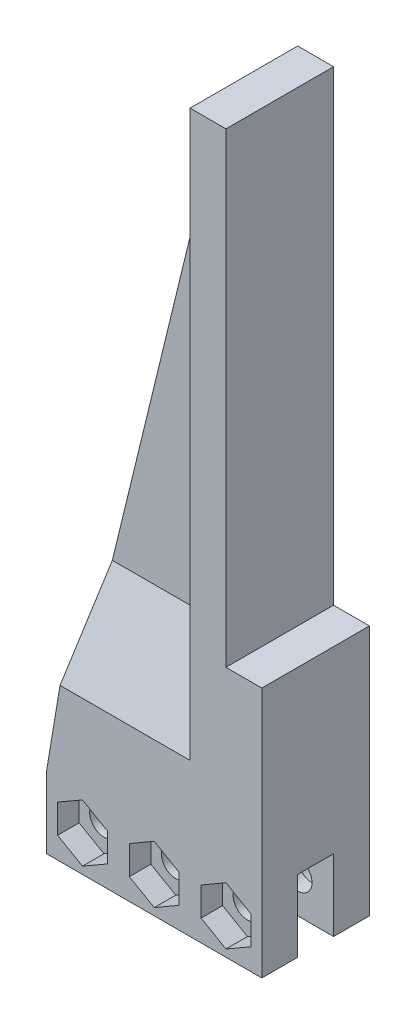
from build123d import *

# Parameters (mm, degrees)
SKETCH1_W                                        = 10
SKETCH1_H                                        = 65
SKETCH1_H_2                                      = 25
SKETCH1_W_2                                      = 5
SKETCH1_H_3                                      = 10
SKETCH1_W_3                                      = 15
BOSS_EXTRUDE1_DEPTH                              = 15
CBORE_FOR_M4_HEX_HEAD_MACHINE_SCREW1_D           = 4
CBORE_FOR_M4_HEX_HEAD_MACHINE_SCREW1_CBORE_D     = 8
CBORE_FOR_M4_HEX_HEAD_MACHINE_SCREW1_CBORE_DEPTH = 3
CUT_EXTRUDE1_DEPTH                               = 3
SKETCH7_W                                        = 5
SKETCH7_H                                        = 10
CUT_EXTRUDE2_DEPTH                               = 106.475115549
CUT_EXTRUDE3_DEPTH                               = 106.475115549
CUT_EXTRUDE4_DEPTH                               = 5
CUT_EXTRUDE5_DEPTH                               = 5
CHAMFER1_SIZE2                                   = 5
CHAMFER1_SIZE                                    = 13.737387097
CHAMFER2_SIZE2                                   = 5
CHAMFER2_SIZE                                    = 13.737387097


with BuildPart() as part:
    # Sketch1 → Boss-Extrude1 (new body)
    with BuildSketch(Plane.XY):
        Polygon((-30, 10), (-15, 10), (-15, 35), (-15, 100), align=None)
        with Locations((-10, 67.5)):
            Rectangle(SKETCH1_W, SKETCH1_H)
        with Locations((-10, 22.5)):
            Rectangle(SKETCH1_W, SKETCH1_H_2)
        with Locations((-2.5, 22.5)):
            Rectangle(SKETCH1_W_2, SKETCH1_H_2)
        with Locations((-2.5, 5)):
            Rectangle(SKETCH1_W_2, SKETCH1_H_3)
        with Locations((-10, 5)):
            Rectangle(SKETCH1_W, SKETCH1_H_3)
        with Locations((-22.5, 5)):
            Rectangle(SKETCH1_W_3, SKETCH1_H_3)
    extrude(amount=BOSS_EXTRUDE1_DEPTH)

    # CBORE for M4 Hex Head Machine Screw1 (through all)
    with Locations(Plane(origin=(0, 0, 0), x_dir=(-1, 0, 0), z_dir=(0, 0, -1))):
        with Locations((25, 5), (15, 5), (5, 5)):
            CounterBoreHole(CBORE_FOR_M4_HEX_HEAD_MACHINE_SCREW1_D / 2, CBORE_FOR_M4_HEX_HEAD_MACHINE_SCREW1_CBORE_D / 2, CBORE_FOR_M4_HEX_HEAD_MACHINE_SCREW1_CBORE_DEPTH)

    # Sketch6 → Cut-Extrude1 (cut)
    with BuildSketch(Plane.XY.offset(15)):
        Polygon((-15, 9), (-18.464101615, 7), (-18.464101615, 3), (-15, 1), (-11.535898385, 3), (-11.535898385, 7), align=None)
        Polygon((-25, 9), (-28.464101615, 7), (-28.464101615, 3), (-25, 1), (-21.535898385, 3), (-21.535898385, 7), align=None)
        Polygon((-5, 9), (-8.464101615, 7), (-8.464101615, 3), (-5, 1), (-1.535898385, 3), (-1.535898385, 7), align=None)
    extrude(amount=-CUT_EXTRUDE1_DEPTH, mode=Mode.SUBTRACT)

    # Sketch7 → Cut-Extrude2 (cut, through all)
    with BuildSketch(Plane.ZY.offset(30)):
        with Locations((7.5, 5)):
            Rectangle(SKETCH7_W, SKETCH7_H)
    extrude(amount=-CUT_EXTRUDE2_DEPTH, mode=Mode.SUBTRACT)

    # Sketch8 → Cut-Extrude3 (cut, through all)
    with BuildSketch(Plane(origin=(0, 0, 0), x_dir=(-1, 0, 0), z_dir=(0, 0, -1))):
        Polygon((15, 100), (10, 100), (25.833333333, 35), align=None)
    extrude(amount=-CUT_EXTRUDE3_DEPTH, mode=Mode.SUBTRACT)

    # Sketch9 → Cut-Extrude4 (cut)
    with BuildSketch(Plane(origin=(0, 0, 0), x_dir=(-1, 0, 0), z_dir=(0, 0, -1))):
        Polygon((10, 100), (10, 35), (25.833333333, 35), align=None)
    extrude(amount=-CUT_EXTRUDE4_DEPTH, mode=Mode.SUBTRACT)

    # Sketch10 → Cut-Extrude5 (cut)
    with BuildSketch(Plane.XY.offset(15)):
        Polygon((-10, 100), (-10, 35), (-25.833333333, 35), align=None)
    extrude(amount=-CUT_EXTRUDE5_DEPTH, mode=Mode.SUBTRACT)

    # Chamfer1
    chamfer1_edges = [part.edges().sort_by_distance(p)[0] for p in [
        (-17.916666667, 35, 15),
    ]]
    chamfer1_side = [part.faces().sort_by_distance(p)[0] for p in [
        (-17.916666667, 34.9, 15),
    ]]
    chamfer(chamfer1_edges, length=CHAMFER1_SIZE - 0.0001, length2=CHAMFER1_SIZE2 - 0.0001, reference=chamfer1_side[0])  # a hair under: the kernel refuses the full size

    # Chamfer2
    chamfer2_edges = [part.edges().sort_by_distance(p)[0] for p in [
        (-17.916666667, 35, 0),
    ]]
    chamfer2_side = [part.faces().sort_by_distance(p)[0] for p in [
        (-17.916666667, 34.9, 0),
    ]]
    chamfer(chamfer2_edges, length=CHAMFER2_SIZE - 0.0001, length2=CHAMFER2_SIZE2 - 0.0001, reference=chamfer2_side[0])  # a hair under: the kernel refuses the full size


solid = part.part
